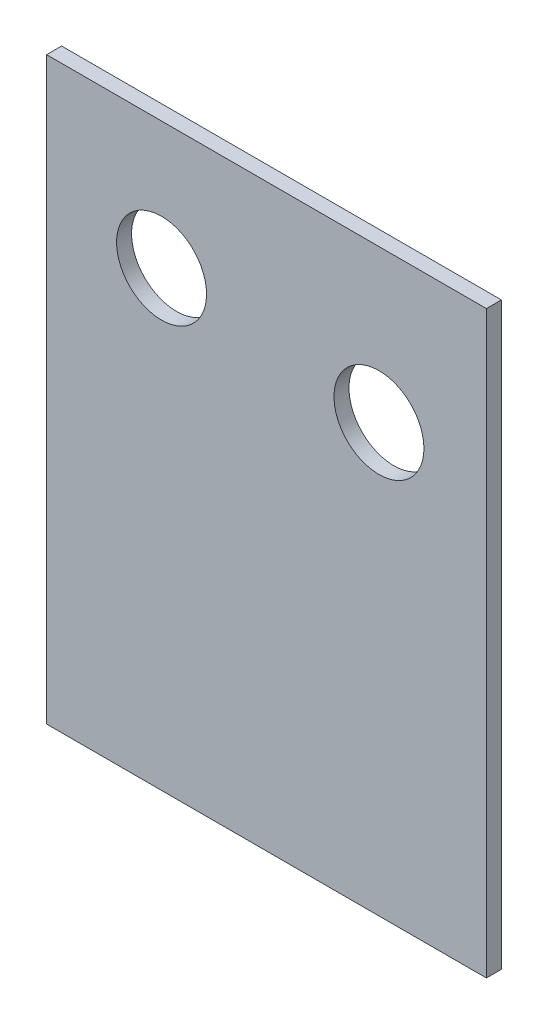
from build123d import *

# Parameters (mm, degrees)
SKETCH1_W           = 88
SKETCH1_H           = 116
BOSS_EXTRUDE1_DEPTH = 3
SKETCH2_R           = 9
CUT_EXTRUDE1_DEPTH  = 73.862884928


with BuildPart() as part:
    # Sketch1 → Boss-Extrude1 (new body)
    with BuildSketch(Plane.XY):
        Rectangle(SKETCH1_W, SKETCH1_H)
    extrude(amount=BOSS_EXTRUDE1_DEPTH)

    # Sketch2 → Cut-Extrude1 (cut, through all)
    with BuildSketch(Plane.XY.offset(3)):
        with Locations((-21, 32.5)):
            Circle(SKETCH2_R)
        with Locations((22.5, 27.5)):
            Circle(SKETCH2_R)
    extrude(amount=-CUT_EXTRUDE1_DEPTH, mode=Mode.SUBTRACT)


solid = part.part
